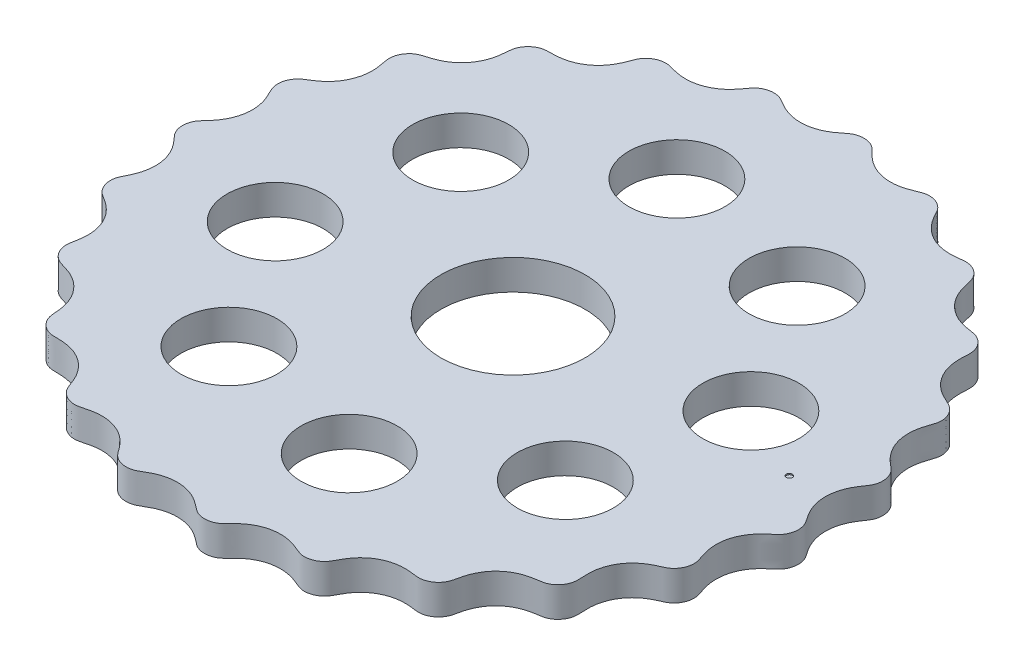
from build123d import *

# Parameters (mm, degrees)
BOSS_EXTRUDE2_DEPTH = 5
SKETCH12_R          = 8
SKETCH12_R_2        = 12
CUT_EXTRUDE1_DEPTH  = 78.857482809
SKETCH13_R          = 0.5
CUT_EXTRUDE2_DEPTH  = 0.2


# Read off the part's stored shape, not the designer's step: Boss-Extrude2
with BuildPart() as part:
    # Boss-Extrude2 outline → Boss-Extrude2 (new body)
    with BuildSketch(Plane(origin=(0, 0, 0), x_dir=(1, 0, 0), z_dir=(0, 1, 0))):
        with BuildLine():
            add(Edge.make_bspline(
                [(52.000030369, 0.018131074), (52.000032137, 0.019186531), (52.000033905, 0.020241988), (52.000037774, 0.022352903), (52.000042978, 0.024463817), (52.000049058, 0.026574728), (52.000057304, 0.02868563), (52.000061832, 0.029741079), (52.000066627, 0.030796527), (52.00044683, 0.114485618), (52.003039545, 0.220957979), (52.009459362, 0.384894731), (52.023106696, 0.589445648), (52.04032733, 0.783981538), (52.072291112, 1.032297416), (52.128152221, 1.383838106), (52.212235751, 1.756043953), (52.316293437, 2.133660941), (52.439588162, 2.502231041), (52.608744749, 2.93329404), (52.835143844, 3.420610051), (53.132241555, 3.954398242), (53.50492333, 4.52941943), (53.859927045, 5.023259919), (54.14823614, 5.473641888), (54.372133576, 5.98144225), (54.514519589, 6.542030737), (54.549488044, 7.218488835), (54.425380683, 7.954670206), (54.158603538, 8.62020083), (53.772429276, 9.192049028), (53.288986541, 9.637426902), (52.714465285, 10.096383616), (52.100625254, 10.639557495), (51.482499967, 11.297153488), (50.903129661, 12.094950439), (50.357825434, 13.100588229), (49.932081186, 14.33501466), (49.760518607, 15.576027273), (49.814027834, 16.766877338), (49.985872169, 17.725558078), (50.1869241, 18.459740888), (50.436186313, 19.18380335), (50.69879926, 19.917062261), (50.773165648, 20.765191344), (50.624143402, 21.536751637), (50.342235373, 22.190579829), (49.943586445, 22.76537959), (49.562716396, 23.149363033), (49.144430403, 23.436863858), (48.636480801, 23.687688955), (48.116599819, 23.911267064), (47.457785159, 24.218948673), (46.687088281, 24.662108376), (45.918258047, 25.231574441), (45.18581898, 25.946601251), (44.559178553, 26.758400701), (44.052936482, 27.652196591), (43.677112943, 28.610071973), (43.438535168, 29.612530476), (43.344025803, 30.542829642), (43.348226255, 31.382101365), (43.394559926, 32.123443668), (43.434228365, 32.772371727), (43.334130719, 33.51460909), (43.012107473, 34.295813341), (42.496632515, 34.97538895), (41.821393782, 35.500068835), (41.120637226, 35.809527599), (40.45783122, 35.930969282), (39.710370981, 36.028491582), (38.883783699, 36.184333479), (37.9949155, 36.444088941), (37.068702888, 36.852074506), (36.084708433, 37.456258729), (35.103383976, 38.310600637), (34.343593265, 39.286415018), (33.800600697, 40.317974418), (33.469246367, 41.210756159), (33.269888413, 41.927820806), (33.115108594, 42.66078778), (32.952613177, 43.40626498), (32.566823317, 44.156961162), (32.033988528, 44.732865587), (31.443066022, 45.141520028), (30.78773965, 45.420436631), (30.249906678, 45.542486227), (29.73335686, 45.557309836), (29.159664254, 45.497753069), (28.683950972, 45.431302105), (28.206155179, 45.379445056), (27.563007437, 45.340610609), (26.850273624, 45.344820989), (25.977172206, 45.440412454), (24.966193599, 45.696815922), (24.008524394, 46.092201611), (23.122649814, 46.616534997), (22.32519735, 47.255730609), (21.62649411, 47.992691752), (21.080875901, 48.744745731), (20.655081331, 49.473345454), (20.311546231, 50.146969036), (19.975357189, 50.733250189), (19.449456862, 51.291600001), (18.729790132, 51.752926608), (17.91840201, 52.012105255), (17.076767621, 52.055682375), (16.345097892, 51.904514321), (15.74782084, 51.651563288), (15.066788988, 51.359785483), (14.279751136, 51.074378534), (13.374350786, 50.850459501), (12.352775461, 50.737175859), (11.325639472, 50.767291469), (10.313420732, 50.941703174), (9.336511533, 51.257621635), (8.414030283, 51.706891972), (7.616837559, 52.240094105), (6.938497677, 52.81805672), (6.426159025, 53.336492166), (6.040439502, 53.75243284), (5.633923722, 54.148885257), (5.223019132, 54.448856066), (4.73301317, 54.68097413), (4.056704572, 54.865887788), (3.345479321, 54.913742123), (2.568598942, 54.796733004), (1.794472788, 54.444623077), (1.192347008, 53.95378031), (0.595651085, 53.477228672), (-0.026607771, 53.042510953), (-0.869150878, 52.559439953), (-1.969251206, 52.109106771), (-3.193279184, 51.852136195), (-4.49825879, 51.835911446), (-5.630153975, 52.009790555), (-6.579565649, 52.287126073), (-7.40952843, 52.648939164), (-8.129733861, 53.045962735), (-8.756760693, 53.434790658), (-9.339605285, 53.743635579), (-10.008707496, 53.917605671), (-10.725319677, 53.947066283), (-11.459901294, 53.81871284), (-12.084618293, 53.561121088), (-12.564852644, 53.241258909), (-12.968684634, 52.862453069), (-13.296752486, 52.441773773), (-13.642238121, 51.943049533), (-14.057398626, 51.400196816), (-14.523256559, 50.869066652), (-15.051221695, 50.364008113), (-15.64339068, 49.897376413), (-16.30137216, 49.482718263), (-17.00112215, 49.139613705), (-17.735848374, 48.873053245), (-18.496563052, 48.687286522), (-19.275115905, 48.583704235), (-20.035980726, 48.564472093), (-20.772292512, 48.616730633), (-21.476069573, 48.731792785), (-22.149148271, 48.88786873), (-22.828471665, 49.086797037), (-23.545057377, 49.245254936), (-24.305778127, 49.206862491), (-25.052477707, 48.990637692), (-25.709076602, 48.627602947), (-26.247828077, 48.156533749), (-26.65831757, 47.606067686), (-26.917574147, 47.009609701), (-27.155114607, 46.321096501), (-27.455898909, 45.567306475), (-27.860356981, 44.769923244), (-28.407197812, 43.960427651), (-29.084955988, 43.193693972), (-29.901359267, 42.500412136), (-30.853668406, 41.91423367), (-31.930426219, 41.469594365), (-32.979074279, 41.217370236), (-33.862644046, 41.123342124), (-34.561419245, 41.103874259), (-35.072420216, 41.101509566), (-35.481413613, 41.092976117), (-35.990841207, 41.038235947), (-36.629843937, 40.84908834), (-37.230285489, 40.501809833), (-37.755541386, 40.016865145), (-38.16454059, 39.455494945), (-38.40042246, 38.97303697), (-38.535393876, 38.487513382), (-38.604920326, 37.929104625), (-38.641241654, 37.368323388), (-38.707773385, 36.64941227), (-38.861582838, 35.780148763), (-39.132635832, 34.869702276), (-39.550665103, 33.943241337), (-40.224813613, 32.87474983), (-41.085982217, 31.94757101), (-42.100092464, 31.197929045), (-43.155367468, 30.672697508), (-43.87332557, 30.406391201), (-44.45112337, 30.232346027), (-44.960576439, 30.085204345), (-45.468774799, 29.930583867), (-46.090125567, 29.613266429), (-46.726681504, 29.03428301), (-47.189682682, 28.319924527), (-47.452609942, 27.524850104), (-47.512655848, 26.772963905), (-47.410085287, 26.112916086), (-47.252376791, 25.382814787), (-47.121168219, 24.560098554), (-47.063881006, 23.644847442), (-47.130497918, 22.645034938), (-47.359653899, 21.517647435), (-47.825704882, 20.301124027), (-48.485210412, 19.247872792), (-49.276579871, 18.378470777), (-50.009955159, 17.758313059), (-50.622823298, 17.324857948), (-51.265992262, 16.928736157), (-51.920996848, 16.525943693), (-52.504628352, 15.912442115), (-52.871495373, 15.218471314), (-53.061222551, 14.528067486), (-53.108464697, 13.822231047), (-53.047945703, 13.278074567), (-52.89496756, 12.78805012), (-52.65124585, 12.269494002), (-52.43043584, 11.846554048), (-52.221816658, 11.417216803), (-51.969003774, 10.82932258), (-51.732239631, 10.162243677), (-51.525586601, 9.314809021), (-51.421069915, 8.284330018), (-51.463260589, 7.25364846), (-51.650601516, 6.243345325), (-51.976796323, 5.273919514), (-52.430898416, 4.361727632), (-52.953911253, 3.586811704), (-53.499693084, 2.932616239), (-54.025220258, 2.374798417), (-54.478118391, 1.856550113), (-54.83711058, 1.169811368), (-55.034947413, 0.335510158), (-55.01186274, -0.514094173), (-54.778076066, -1.317133735), (-54.400219233, -1.955421394), (-53.96770458, -2.432939414), (-53.467039485, -2.971635471), (-52.935967953, -3.610882459), (-52.278606125, -4.591384351), (-51.760099636, -5.765733889), (-51.470648514, -7.020696486), (-51.421824826, -8.304933891), (-51.528884391, -9.332796191), (-51.736885581, -10.177807464), (-51.974337094, -10.842943635), (-52.227383124, -11.429135671), (-52.435907873, -11.857309308), (-52.656310601, -12.279236615), (-52.898494091, -12.797104648), (-53.049509281, -13.286547334), (-53.108554152, -13.82954616), (-53.060066371, -14.533740152), (-52.869504011, -15.223105952), (-52.501758443, -15.916793548), (-51.916304224, -16.529821567), (-51.259021356, -16.932645802), (-50.614433421, -17.330372639), (-50.000279424, -17.765633063), (-49.265906726, -18.388747619), (-48.474173304, -19.262204196), (-47.816513455, -20.318916038), (-47.353872726, -21.537308958), (-47.128189444, -22.663974013), (-47.0640498, -23.660635467), (-47.122742818, -24.572830327), (-47.254344407, -25.392817974), (-47.411785145, -26.120668463), (-47.512719062, -26.779041717), (-47.451437235, -27.529884741), (-47.18743027, -28.324853566), (-46.722654213, -29.039421691), (-46.083276946, -29.618468265), (-45.459351766, -29.934363203), (-44.949719244, -30.088282359), (-44.439097669, -30.23584306), (-43.860065735, -30.410801546), (-43.140822209, -30.678916831), (-42.308497115, -31.095368481), (-41.477067355, -31.658962076), (-40.769574482, -32.294791401), (-40.184549595, -32.975731686), (-39.714812131, -33.676610793), (-39.348029448, -34.377446849), (-39.067622281, -35.090950805), (-38.864332208, -35.806245525), (-38.732134902, -36.512331493), (-38.651081084, -37.203935915), (-38.609265456, -37.915376471), (-38.524713023, -38.649570204), (-38.238055749, -39.360621818), (-37.784565013, -39.999385109), (-37.189423085, -40.529689696), (-36.571053541, -40.867136891), (-35.985309788, -41.039520028), (-35.474662162, -41.093314412), (-35.06448753, -41.101568148), (-34.552215778, -41.103954996), (-33.851598039, -41.124040639), (-32.965861113, -41.219521425), (-31.914930238, -41.474416244), (-30.836432097, -41.922816973), (-29.884479867, -42.512547167), (-29.070140988, -43.208297285), (-28.395529087, -43.975831686), (-27.852227068, -44.784115808), (-27.450439616, -45.57973743), (-27.151408749, -46.331418175), (-26.914687855, -47.017718789), (-26.654881606, -47.611571298), (-26.244170786, -48.160281512), (-25.704949757, -48.630566345), (-25.047115154, -48.993013268), (-24.298288021, -49.208357151), (-23.535682118, -49.244631961), (-22.818011724, -49.083610051), (-22.136985896, -48.884673787), (-21.462068627, -48.72888194), (-20.756365646, -48.614851431), (-20.018183195, -48.563990046), (-19.255535924, -48.585206161), (-18.475474337, -48.691179041), (-17.657981702, -48.893518064), (-16.817828873, -49.211584485), (-15.976481927, -49.661498119), (-15.15986859, -50.254909317), (-14.482477768, -50.899895656), (-13.984826892, -51.489197666), (-13.623093664, -51.977660787), (-13.312147428, -52.41170938), (-13.047988823, -52.770763022), (-12.738228131, -53.09360971), (-12.25262138, -53.459993379), (-11.641967049, -53.767021793), (-10.897992614, -53.947032526), (-10.060661652, -53.932148749), (-9.333495076, -53.741338642), (-8.749360902, -53.430309876), (-8.120256821, -53.040244557), (-7.397298503, -52.642802112), (-6.56412669, -52.281349737), (-5.611183571, -52.005423351), (-4.477652149, -51.834597219), (-3.173401306, -51.854685573), (-1.952064077, -52.114562368), (-0.855888292, -52.56596355), (-0.01646335, -53.049121503), (0.603671192, -53.483263617), (1.198362872, -53.959043014), (1.799676063, -54.447791722), (2.573667846, -54.798000621), (3.350516262, -54.914090696), (4.062452551, -54.865103798), (4.739909108, -54.678478668), (5.230531347, -54.444600475), (5.641358248, -54.142585368), (6.047955038, -53.744404902), (6.434615322, -53.327538758), (6.948675716, -52.808483229), (7.629624089, -52.230300765), (8.429802271, -51.697728592), (9.35567225, -51.249696665), (10.578707684, -50.858494545), (11.858738233, -50.70288529), (13.143475546, -50.791519901), (14.29457145, -51.079144366), (15.079394349, -51.364758871), (15.758489201, -51.656476036), (16.354937715, -51.907673172), (17.08540046, -52.055925186), (17.924827822, -52.010651544), (18.734696487, -51.750483267), (19.453559012, -51.288400409), (19.979103125, -50.728424386), (20.315107209, -50.139821234), (20.659942505, -49.464294115), (21.087810797, -48.733847603), (21.636518691, -47.980356837), (22.33918503, -47.242604417), (23.139948366, -46.604502637), (24.027828973, -46.082650138), (24.985796954, -45.690509787), (25.995146742, -45.437341347), (26.866478963, -45.343905226), (27.577612715, -45.340990953), (28.21927201, -45.380659527), (28.695959341, -45.432834716), (29.170605062, -45.499291057), (29.743164868, -45.557703533), (30.258542551, -45.541180729), (30.794787444, -45.418081181), (31.448112358, -45.138507463), (32.037740857, -44.729417748), (32.569979521, -44.152800439), (32.954741458, -43.400565945), (33.116464761, -42.652912114), (33.272248474, -41.918059316), (33.472863794, -41.199152497), (33.806644985, -40.30440971), (34.35331746, -39.271103958), (35.116984989, -38.295825393), (36.101249884, -37.444046959), (37.085764714, -36.843394894), (38.009884585, -36.438851281), (38.896338918, -36.181486345), (39.720518386, -36.026970684), (40.465709295, -35.929983809), (41.126461206, -35.80760475), (41.817483306, -35.500884314), (42.479895404, -34.988946857), (42.998168022, -34.316891634), (43.33323017, -33.528831511), (43.439301079, -32.752724752), (43.387851154, -32.048926394), (43.343890043, -31.274410897), (43.351051871, -30.424023231), (43.487839722, -29.259240335), (43.846047211, -28.054257938), (44.424174145, -26.93005655), (45.199567697, -25.931272493), (45.932399667, -25.219840781), (46.700538533, -24.653391235), (47.470307946, -24.212595235), (48.127843991, -23.906311767), (48.64658512, -23.68327424), (49.152824911, -23.43190244), (49.569224272, -23.143666729), (49.948225624, -22.759688644), (50.344887364, -22.18541159), (50.625485816, -21.531881718), (50.773657784, -20.759981329), (50.697522087, -19.91110215), (50.433240226, -19.176372812), (50.183942668, -18.450159741), (49.983075695, -17.713794725), (49.812384598, -16.752215837), (49.761215606, -15.558049654), (49.936442215, -14.315498957), (50.366043319, -13.081709878), (50.913669658, -12.078633475), (51.493105844, -11.284629239), (52.110550404, -10.630133675), (52.722932939, -10.08942321), (53.295781333, -9.631923005), (53.776417272, -9.187092666), (54.161096789, -8.615317574), (54.426538385, -7.95009667), (54.550425421, -7.212131442), (54.507681678, -6.439181673), (54.293722963, -5.712560579), (53.956614155, -5.162984986), (53.646787209, -4.728778017), (53.358558332, -4.302088685), (53.082585896, -3.867472164), (52.828289918, -3.406739948), (52.601751968, -2.916937772), (52.398092381, -2.395935156), (52.252405314, -1.924907774), (52.139878776, -1.460076023), (52.069189648, -1.012961024), (52.037929699, -0.760674003), (52.021276811, -0.56629285), (52.008247688, -0.361823824), (52.002349068, -0.19733133), (52.000103954, -0.090516036), (52.000003948, -0.006620789), (52.000002689, -0.005565416), (52.000001698, -0.004510043), (52.000000525, -0.002399296), (52.000001518, -0.000288547), (52.000003386, 0.001822202), (52.000006588, 0.003932947), (52.000008355, 0.004988319), (52.000010123, 0.006043691), (52.000015185, 0.009065537), (52.000020246, 0.012087383), (52.000025308, 0.015109228), (52.000030369, 0.018131074)],
                knots=[0, 0, 0, 0, 0, 1.297e-05, 1.297e-05, 2.594e-05, 2.594e-05, 3.891e-05, 3.891e-05, 3.891e-05, 3.891e-05, 0.001067326, 0.001329517, 0.001591709, 0.002116091, 0.003164857, 0.004213622, 0.005262388, 0.006311154, 0.007359919, 0.008408685, 0.010253968, 0.012099251, 0.013944535, 0.015789818, 0.016820025, 0.017850232, 0.019910647, 0.021988799, 0.024066951, 0.025830409, 0.027593867, 0.029357325, 0.031120783, 0.033770816, 0.036420849, 0.039070882, 0.041720915, 0.046071816, 0.050422716, 0.052470206, 0.054517695, 0.056565184, 0.058612674, 0.060746667, 0.06288066, 0.065621033, 0.06699122, 0.068361407, 0.070396057, 0.071413382, 0.072430706, 0.074465356, 0.076500006, 0.079250781, 0.082001555, 0.08475233, 0.087503104, 0.090272388, 0.093041672, 0.095810956, 0.09858024, 0.10032962, 0.102079, 0.103828381, 0.105577761, 0.108333997, 0.111090234, 0.112898084, 0.114705935, 0.116513786, 0.118321637, 0.121041074, 0.123760512, 0.126479949, 0.129199387, 0.133455646, 0.137711906, 0.139713818, 0.141715731, 0.143717643, 0.145719556, 0.147812109, 0.149904663, 0.152696049, 0.154091743, 0.155487436, 0.15755981, 0.158595997, 0.159632183, 0.161704557, 0.162740744, 0.163776931, 0.166579099, 0.169381266, 0.172183434, 0.174985601, 0.177714198, 0.180442795, 0.183171392, 0.18589999, 0.187713325, 0.189526661, 0.191339996, 0.193153332, 0.195902733, 0.198652134, 0.200397237, 0.20214234, 0.203887443, 0.205632546, 0.208394794, 0.211157041, 0.213919289, 0.216681537, 0.219438909, 0.222196282, 0.224953655, 0.227711028, 0.229750539, 0.231790049, 0.232809804, 0.23382956, 0.23586907, 0.237242507, 0.238615944, 0.241362819, 0.243491468, 0.245620117, 0.247661829, 0.24970354, 0.251745251, 0.253786963, 0.258125799, 0.262464636, 0.265122945, 0.267781254, 0.270439563, 0.273097872, 0.274867551, 0.27663723, 0.278406909, 0.280176588, 0.282249568, 0.284322548, 0.286378389, 0.287406309, 0.28843423, 0.290274774, 0.292115319, 0.293955864, 0.295796409, 0.297888793, 0.299981178, 0.302073563, 0.304165947, 0.306278531, 0.308391115, 0.310503699, 0.312616283, 0.314475319, 0.316334355, 0.31819339, 0.320052426, 0.322126442, 0.324200457, 0.326293724, 0.32838699, 0.330132345, 0.331877699, 0.333623053, 0.335368408, 0.33799427, 0.340620133, 0.343245995, 0.345871858, 0.348999125, 0.352126393, 0.35525366, 0.358380927, 0.360585793, 0.361688226, 0.362790659, 0.363893092, 0.364995525, 0.367200391, 0.369921676, 0.371282319, 0.372642961, 0.374663414, 0.37567364, 0.376683867, 0.37870432, 0.380724773, 0.383456213, 0.386187653, 0.388919093, 0.391650533, 0.397036342, 0.399729247, 0.402422152, 0.404329166, 0.405282673, 0.40623618, 0.408143194, 0.410050209, 0.41273009, 0.415409972, 0.417201862, 0.418993752, 0.420785641, 0.422577531, 0.425270188, 0.427962845, 0.430655501, 0.433348158, 0.437639946, 0.441931733, 0.443950823, 0.445969912, 0.447989002, 0.450008091, 0.452116078, 0.454224064, 0.456996081, 0.45838209, 0.459768098, 0.461826528, 0.462855743, 0.463884958, 0.465943387, 0.466972602, 0.468001817, 0.470784787, 0.473567757, 0.476350727, 0.479133696, 0.481871538, 0.48460938, 0.487347221, 0.490085063, 0.491932133, 0.493779202, 0.495626272, 0.497473342, 0.500202716, 0.502932091, 0.504664802, 0.506397513, 0.508130224, 0.509862935, 0.512604539, 0.515346144, 0.520829354, 0.523605994, 0.526382635, 0.529159276, 0.531935916, 0.532962788, 0.53398966, 0.536043403, 0.537070274, 0.538097146, 0.540150889, 0.541533795, 0.542916701, 0.545682513, 0.547795599, 0.549908685, 0.551933398, 0.553958112, 0.555982825, 0.558007538, 0.562310995, 0.566614452, 0.569298301, 0.571982151, 0.574666, 0.577349849, 0.579136515, 0.58092318, 0.582709846, 0.584496512, 0.587182764, 0.589869017, 0.591780453, 0.593691889, 0.594647607, 0.595603325, 0.597514761, 0.600214259, 0.602913758, 0.605613256, 0.608312754, 0.610440384, 0.612568014, 0.614695644, 0.616823274, 0.618696304, 0.620569334, 0.622442364, 0.624315394, 0.626402517, 0.628489641, 0.630597993, 0.632706346, 0.634916953, 0.636022256, 0.637127559, 0.638232862, 0.639338166, 0.641548772, 0.644684161, 0.647819549, 0.650954938, 0.654090327, 0.656708247, 0.659326168, 0.661944089, 0.66456201, 0.66630144, 0.66804087, 0.6697803, 0.671519731, 0.673617965, 0.675716199, 0.67779461, 0.67987302, 0.681736621, 0.683600222, 0.685463824, 0.687327425, 0.689444961, 0.691562497, 0.693680034, 0.69579757, 0.69851049, 0.701223411, 0.703936331, 0.706649252, 0.708569557, 0.709529709, 0.710489861, 0.712410166, 0.713370318, 0.714330471, 0.717030064, 0.719729658, 0.721505339, 0.723281021, 0.725056703, 0.726832384, 0.729498666, 0.732164947, 0.734831228, 0.737497509, 0.741824718, 0.746151926, 0.74818806, 0.750224193, 0.752260326, 0.75429646, 0.756419977, 0.758543493, 0.761296612, 0.762673172, 0.764049732, 0.766093924, 0.76711602, 0.768138116, 0.770182308, 0.7722265, 0.774990219, 0.777753938, 0.780517657, 0.783281376, 0.788792305, 0.79154777, 0.794303234, 0.796044239, 0.797785244, 0.799526249, 0.801267254, 0.80401007, 0.806752886, 0.808571515, 0.810390143, 0.812208771, 0.814027399, 0.816764815, 0.81950223, 0.822239646, 0.824977061, 0.827772917, 0.830568774, 0.83336463, 0.836160486, 0.837194389, 0.838228293, 0.8402961, 0.841330003, 0.842363907, 0.844431714, 0.845824206, 0.847216698, 0.850001682, 0.852099303, 0.854196925, 0.856204504, 0.858212083, 0.860219662, 0.862227241, 0.866495202, 0.870763163, 0.873473786, 0.876184408, 0.87889503, 0.881605653, 0.883408237, 0.885210822, 0.887013406, 0.888815991, 0.891482865, 0.89414974, 0.89604778, 0.897945821, 0.899843861, 0.901741901, 0.904421342, 0.907100782, 0.912459663, 0.915204081, 0.917948498, 0.920692915, 0.923437333, 0.925467307, 0.927497281, 0.928512268, 0.929527256, 0.93155723, 0.932924282, 0.934291333, 0.937025437, 0.939164585, 0.941303733, 0.943356768, 0.945409803, 0.947462838, 0.949515873, 0.95387837, 0.958240866, 0.960882939, 0.963525013, 0.966167086, 0.968809159, 0.970566643, 0.972324128, 0.974081613, 0.975839097, 0.977922225, 0.980005354, 0.982070206, 0.984135058, 0.985984885, 0.986909799, 0.987834713, 0.989684541, 0.991534369, 0.992585612, 0.993636854, 0.995739339, 0.996790581, 0.997841824, 0.998367445, 0.998630256, 0.998893066, 0.999923963, 0.999923963, 0.999923963, 0.999923963, 0.999936931, 0.999936931, 0.9999499, 0.9999499, 0.999962868, 0.999962868, 0.999962868, 0.999962868, 1, 1, 1, 1, 1], degree=4))
        make_face()
    extrude(amount=BOSS_EXTRUDE2_DEPTH)

    # Sketch12 → Cut-Extrude1 (cut, through all)
    with BuildSketch(Plane(origin=(0, 5, 0), x_dir=(1, 0, 0), z_dir=(0, 1, 0))):
        with Locations(Location((33.437697856, 6.15795113, 0), (0, 0, 270))):
            Circle(SKETCH12_R)
        with Locations(Location((27.998351903, -19.289693899, 0), (0, 0, 270))):
            Circle(SKETCH12_R)
        with Locations(Location((6.15795113, -33.437697856, 0), (0, 0, 270))):
            Circle(SKETCH12_R)
        with Locations(Location((-19.289693899, -27.998351903, 0), (0, 0, 270))):
            Circle(SKETCH12_R)
        with Locations(Location((-33.437697856, -6.15795113, 0), (0, 0, 270))):
            Circle(SKETCH12_R)
        with Locations(Location((-27.998351903, 19.289693899, 0), (0, 0, 270))):
            Circle(SKETCH12_R)
        with Locations(Location((0, 0, 0), (0, 0, 270))):
            Circle(SKETCH12_R_2)
        with Locations(Location((-6.15795113, 33.437697856, 0), (0, 0, 270))):
            Circle(SKETCH12_R)
        with Locations(Location((19.289693899, 27.998351903, 0), (0, 0, 270))):
            Circle(SKETCH12_R)
    extrude(amount=-CUT_EXTRUDE1_DEPTH, mode=Mode.SUBTRACT)

    # Sketch13 → Cut-Extrude2 (cut)
    with BuildSketch(Plane(origin=(0, 5, 0), x_dir=(1, 0, 0), z_dir=(0, 1, 0))):
        with Locations(Location((46, 0, 0), (0, 0, 270))):
            Circle(SKETCH13_R)
    extrude(amount=-CUT_EXTRUDE2_DEPTH, mode=Mode.SUBTRACT)


solid = part.part
